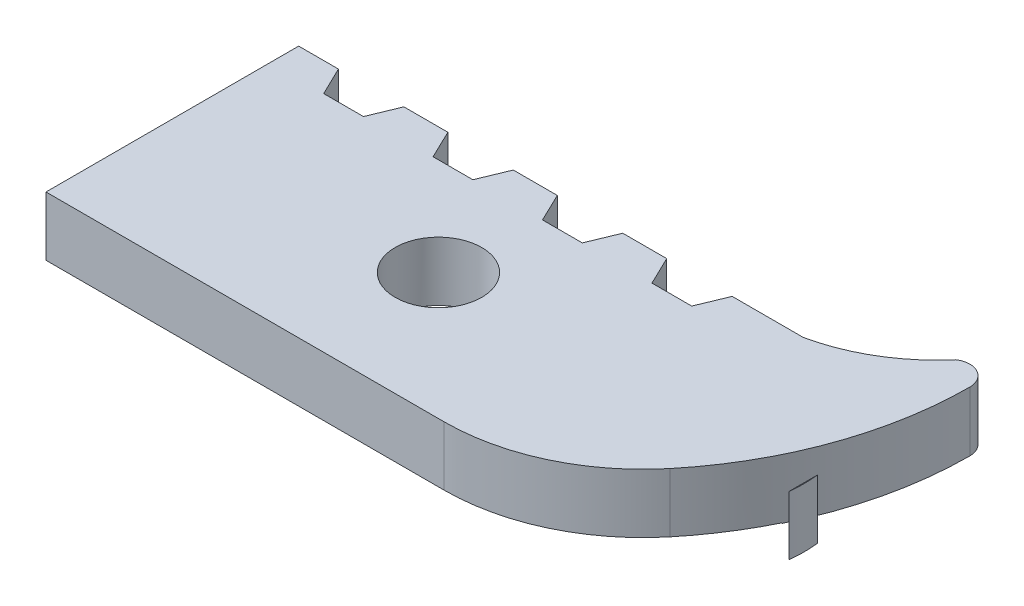
from build123d import *

# Parameters (mm, degrees)
BOSS_EXTRUDE1_DEPTH = 2.975
SKETCH3_R           = 2.175
CUT_EXTRUDE1_DEPTH  = 10
BOSS_EXTRUDE2_DEPTH = 3
CUT_EXTRUDE8_DEPTH  = 25.915072382
FILLET1_R           = 10


with BuildPart() as part:
    # Sketch1 → Boss-Extrude1 (new body)
    with BuildSketch(Plane(origin=(0, 0, 0), x_dir=(1, 0, 0), z_dir=(0, 1, 0))):
        with BuildLine():
            Line((-23.171929825, 5.625877193), (-23.171929825, -7.074122807))
            Line((-23.171929825, -7.074122807), (2.228070175, -7.074122807))
            ThreePointArc((2.228070175, -7.074122807), (8.578070175, -0.724122807), (2.228070175, 5.625877193))
            Line((2.228070175, 5.625877193), (-23.171929825, 5.625877193))
        make_face()
    extrude(amount=BOSS_EXTRUDE1_DEPTH)

    # Sketch3 → Cut-Extrude1 (cut)
    with BuildSketch(Plane(origin=(0, 2.975, 0), x_dir=(1, 0, 0), z_dir=(0, 1, 0))):
        Polygon((-1.382133224, 5.625877193), (-4.671929825, 5.625877193), (-3.976894991, 4.187255521), (-1.976894991, 4.187255521), align=None)
        Polygon((-6.882133224, 5.625877193), (-10.171929825, 5.625877193), (-9.476894991, 4.187255521), (-7.476894991, 4.187255521), align=None)
        Polygon((-12.382133224, 5.625877193), (-15.671929825, 5.625877193), (-14.976894991, 4.187255521), (-12.976894991, 4.187255521), align=None)
        Polygon((-17.882133224, 5.625877193), (-21.171929825, 5.625877193), (-20.476894991, 4.187255521), (-18.476894991, 4.187255521), align=None)
        with Locations((-9.806894991, -0.713854538)):
            Circle(SKETCH3_R)
    extrude(amount=-CUT_EXTRUDE1_DEPTH, mode=Mode.SUBTRACT)

    # Sketch4 → Boss-Extrude2 (add)
    with BuildSketch(Plane(origin=(0, 2.975, 0), x_dir=(1, 0, 0), z_dir=(0, 1, 0))):
        with BuildLine():
            Line((2.186647365, 0), (8.536647365, 0))
            Line((8.536647365, 0), (8.536647365, 7.65))
            ThreePointArc((8.536647365, 7.65), (8.020770284, 8.525), (7.005397365, 8.497215107))
            ThreePointArc((7.005397365, 8.497215107), (4.832348048, 6.664938569), (2.186647365, 5.625877193))
            Line((2.186647365, 5.625877193), (2.186647365, 0))
        make_face()
    extrude(amount=-BOSS_EXTRUDE2_DEPTH)

    # Sketch11 → Cut-Extrude8 (cut, through all)
    with BuildSketch(Plane(origin=(0, 2.975, 0), x_dir=(1, 0, 0), z_dir=(0, 1, 0))):
        with BuildLine():
            Line((8.536647365, 7.65), (8.536647365, -8.35))
            Line((8.536647365, -8.35), (-1.963352635, -8.35))
            ThreePointArc((-1.963352635, -8.35), (5.667529338, -1.912453794), (8.536647365, 7.65))
        make_face()
    extrude(amount=-CUT_EXTRUDE8_DEPTH, mode=Mode.SUBTRACT)


with BuildPart() as cut_extrude8_piece_1:
    # of the separate pieces the step leaves, piece 1, a body of its own (cut_extrude8_pieces)
    add(part.part.solids().sort_by_distance((-23.171929825, 2.975, -5.625877193))[0])

    # Fillet1
    fillet1_edges = [cut_extrude8_piece_1.edges().sort_by_distance(p)[0] for p in [
        (0.433456465, 1.4875, 7.074122807),
    ]]
    fillet(fillet1_edges, radius=FILLET1_R)


with BuildPart() as cut_extrude8_piece_2:
    # of the separate pieces the step leaves, piece 2, a body of its own (cut_extrude8_pieces)
    add(part.part.solids().sort_by_distance((8.536647365, 2.975, 0))[0])


solid = Compound([cut_extrude8_piece_1.part, cut_extrude8_piece_2.part])
